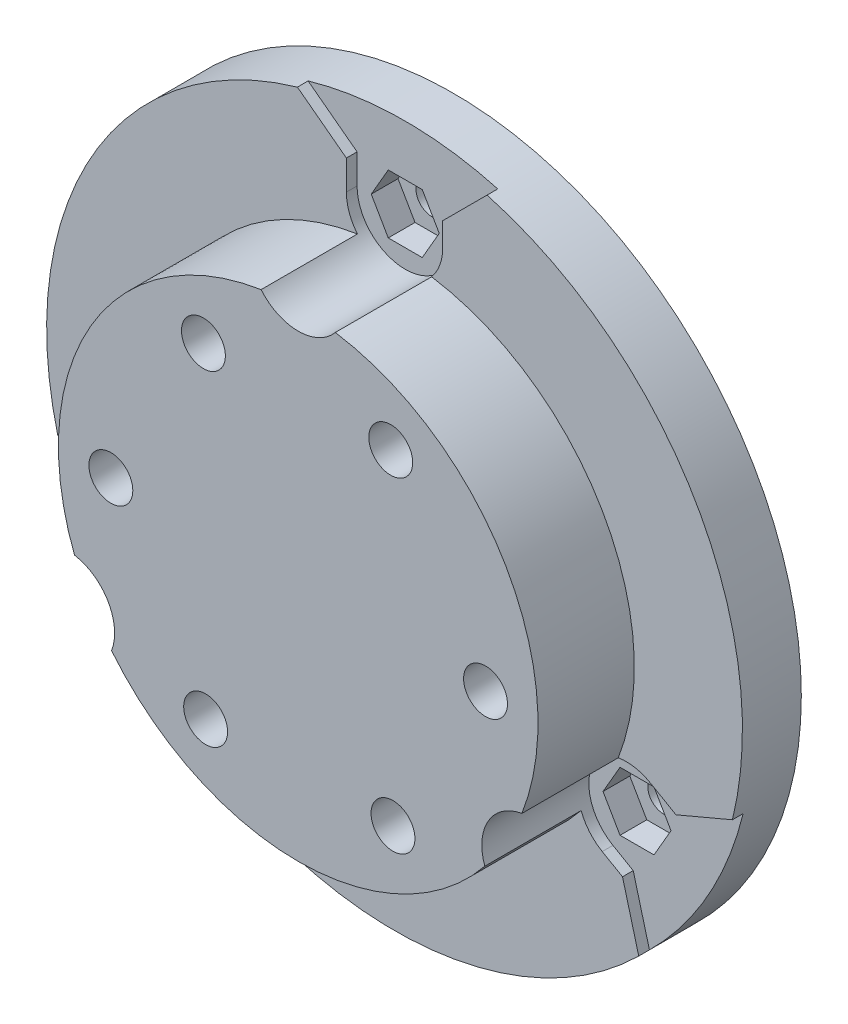
from build123d import *

# Parameters (mm, degrees)
SKETCH2_R           = 32.5
BOSS_EXTRUDE1_DEPTH = 10
SKETCH3_R           = 1.5
CUT_EXTRUDE2_DEPTH  = 48.037219306
CUT_EXTRUDE3_DEPTH  = 8
CUT_EXTRUDE5_START  = -5.5
CUT_EXTRUDE5_DEPTH  = 5.5
CIRPATTERN1_COUNT   = 3
CUT_EXTRUDE8_START  = -4.5
SKETCH8_R           = 22.4
CUT_EXTRUDE8_DEPTH  = 4.5
CHAMFER1_SIZE       = 4.429367468
CHAMFER1_SIZE_2     = 5
SKETCH7_R           = 6.1
CUT_EXTRUDE7_DEPTH  = 4
BOSS_EXTRUDE2_DEPTH = 4.5
SKETCH10_R          = 2.05
CUT_EXTRUDE9_DEPTH  = 7.5


with BuildPart() as part:
    # Sketch2 → Boss-Extrude1 (new body)
    with BuildSketch(Plane.XY):
        Circle(SKETCH2_R)
    extrude(amount=BOSS_EXTRUDE1_DEPTH)

    # Sketch3 → Cut-Extrude2 (cut, symmetric)
    with BuildSketch(Plane.XY):
        with Locations((0, 25)):
            Circle(SKETCH3_R)
    cut_extrude2 = extrude(amount=CUT_EXTRUDE2_DEPTH, both=True, mode=Mode.SUBTRACT)

    # Sketch4 → Cut-Extrude3 (cut)
    with BuildSketch(Plane.XY.offset(10)):
        Polygon((1.58771324, 22.25), (3.175426481, 25), (1.58771324, 27.75), (-1.58771324, 27.75), (-3.175426481, 25), (-1.58771324, 22.25), align=None)
    cut_extrude3 = extrude(amount=-CUT_EXTRUDE3_DEPTH, mode=Mode.SUBTRACT)

    # Sketch5 → Cut-Extrude5 (cut)
    with BuildSketch(Plane.XY.offset(10).offset(CUT_EXTRUDE5_START)):
        with BuildLine():
            Line((4.5, 25), (4.5, 32.186953879))
            ThreePointArc((4.5, 32.186953879), (0, 32.5), (-4.5, 32.186953879))
            Line((-4.5, 32.186953879), (-4.5, 25))
            ThreePointArc((-4.5, 25), (0, 20.5), (4.5, 25))
        make_face()
    cut_extrude5 = extrude(amount=CUT_EXTRUDE5_DEPTH, mode=Mode.SUBTRACT)

    # CirPattern1: Cut-Extrude2, Cut-Extrude3, Cut-Extrude5 ×3 about axis
    cirpattern1_axis = Axis((0, 0, 0), (0, 0, 1))
    add([cut_extrude2.rotate(cirpattern1_axis, i * 360 / CIRPATTERN1_COUNT) for i in range(1, CIRPATTERN1_COUNT)], mode=Mode.SUBTRACT)
    add([cut_extrude3.rotate(cirpattern1_axis, i * 360 / CIRPATTERN1_COUNT) for i in range(1, CIRPATTERN1_COUNT)], mode=Mode.SUBTRACT)
    add([cut_extrude5.rotate(cirpattern1_axis, i * 360 / CIRPATTERN1_COUNT) for i in range(1, CIRPATTERN1_COUNT)], mode=Mode.SUBTRACT)

    # Sketch8 → Cut-Extrude8 (cut)
    with BuildSketch(Plane.XY.offset(10).offset(CUT_EXTRUDE8_START)):
        with BuildLine():
            ThreePointArc((-30.12471973, -12.196362622), (-28.145825623, -16.25), (-25.62471973, -19.990591256))
            ThreePointArc((-25.62471973, -19.990591256), (0, -32.5), (25.62471973, -19.990591256))
            ThreePointArc((25.62471973, -19.990591256), (28.145825623, -16.25), (30.12471973, -12.196362622))
            ThreePointArc((30.12471973, -12.196362622), (28.145825623, 16.25), (4.5, 32.186953879))
            ThreePointArc((4.5, 32.186953879), (0, 32.5), (-4.5, 32.186953879))
            ThreePointArc((-4.5, 32.186953879), (-28.145825623, 16.25), (-30.12471973, -12.196362622))
        make_face()
        Circle(SKETCH8_R, mode=Mode.SUBTRACT)
    extrude(amount=CUT_EXTRUDE8_DEPTH, mode=Mode.SUBTRACT)

    # Chamfer1
    # the kernel refuses this chamfer: 5, 4.429367468 mm, written as the material it takes off along each edge
    with BuildSketch(Plane(origin=(-25.62471973, -19.990591256, 4.5), x_dir=(0.6702188271711587, -0.7421635424253312, 0), z_dir=(0, 0, 1)), Plane(origin=(30.12471973, -12.196362622, 4.5), x_dir=(0.3076230679174066, 0.9515083016375017, 0), z_dir=(0, 0, 1)), Plane(origin=(-4.5, 32.186953879, 4.5), x_dir=(-0.977841895088566, -0.2093447592121711, 0), z_dir=(0, 0, 1))) as chamfer1_piece_1:
        with BuildLine():
            Line((4.675763163, 0), (CHAMFER1_SIZE * 0.209344759198, CHAMFER1_SIZE * 0.977841895022))
            Line((CHAMFER1_SIZE * 0.209344759198, CHAMFER1_SIZE * 0.977841895022), (0, 0))
            ThreePointArc((0, 0), (2.403339666, -0.084130686), (4.675763163, 0))
        make_face()
    extrude(amount=13.02255857, mode=Mode.SUBTRACT)
    with BuildSketch(Plane(origin=(-30.12471973, -12.196362622, 4.5), x_dir=(-0.3141485775889788, 0.9493738311112337, 0), z_dir=(0, 0, 1)), Plane(origin=(25.62471973, -19.990591256, 4.5), x_dir=(-0.6651075666359972, -0.7467475643104184, 0), z_dir=(0, 0, 1)), Plane(origin=(4.5, 32.186953879, 4.5), x_dir=(0.9792561442249751, -0.20262626680081466, 0), z_dir=(0, 0, 1))) as chamfer1_piece_2:
        with BuildLine():
            Line((4.23053931, 0), (CHAMFER1_SIZE_2 * 0.202626266801, -CHAMFER1_SIZE_2 * 0.979256144225))
            Line((CHAMFER1_SIZE_2 * 0.202626266801, -CHAMFER1_SIZE_2 * 0.979256144225), (0, 0))
            ThreePointArc((0, 0), (2.170160838, 0.068863095), (4.23053931, 0))
        make_face()
    extrude(amount=13.85841494, mode=Mode.SUBTRACT)

    # Sketch7 → Cut-Extrude7 (cut)
    with BuildSketch(Plane(origin=(0, 0, 0), x_dir=(-1, 0, 0), z_dir=(0, 0, -1))):
        Circle(SKETCH7_R)
    extrude(amount=-CUT_EXTRUDE7_DEPTH, mode=Mode.SUBTRACT)

    # Sketch9 → Boss-Extrude2 (add)
    with BuildSketch(Plane.XY.offset(10)):
        with BuildLine():
            ThreePointArc((-3.466157521, 22.1302), (0, 20.5), (3.466157521, 22.1302))
            ThreePointArc((3.466157521, 22.1302), (19.398969045, 11.2), (20.898394151, -8.063319533))
            ThreePointArc((20.898394151, -8.063319533), (17.753520778, -10.25), (17.43223663, -14.066880467))
            ThreePointArc((17.43223663, -14.066880467), (0, -22.4), (-17.43223663, -14.066880467))
            ThreePointArc((-17.43223663, -14.066880467), (-17.753520778, -10.25), (-20.898394151, -8.063319533))
            ThreePointArc((-20.898394151, -8.063319533), (-19.398969045, 11.2), (-3.466157521, 22.1302))
        make_face()
    extrude(amount=BOSS_EXTRUDE2_DEPTH)

    # Sketch10 → Cut-Extrude9 (cut)
    with BuildSketch(Plane.XY.offset(14.5)):
        with Locations((-8.645741201, -15.215162144)):
            Circle(SKETCH10_R)
        with Locations((-17.49958754, -0.120149557)):
            Circle(SKETCH10_R)
        with Locations((-8.853846339, 15.095012587)):
            Circle(SKETCH10_R)
        with Locations((8.645741201, 15.215162144)):
            Circle(SKETCH10_R)
        with Locations((17.49958754, 0.120149557)):
            Circle(SKETCH10_R)
        with Locations((8.853846339, -15.095012587)):
            Circle(SKETCH10_R)
    extrude(amount=-CUT_EXTRUDE9_DEPTH, mode=Mode.SUBTRACT)


solid = part.part
